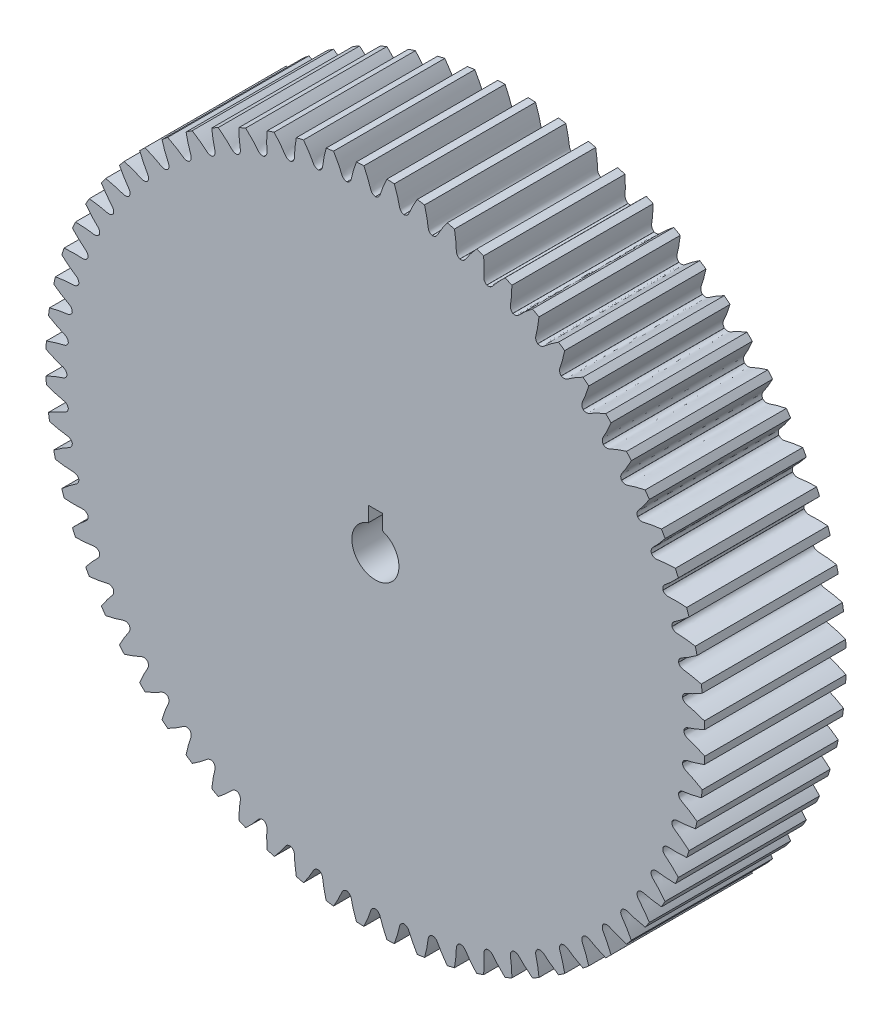
from build123d import *

# Parameters (mm, degrees)
SKETCH_1_R               = 70
EXTRUDE_1_DEPTH          = 30
CUT_EXTRUDE_1_DEPTH      = 104.440804328
PATTERN_CIRCULAR_1_COUNT = 68
CUT_EXTRUDE_2_DEPTH      = 104.383147826
SKETCH_5_R               = 27.463688529
EXTRUDE_2_DEPTH          = 30
CUT_EXTRUDE_3_DEPTH      = 104.383147826


with BuildPart() as part:
    # 草图1 → 凸台-拉伸1 (new body)
    with BuildSketch(Plane.XY):
        Circle(SKETCH_1_R)
    extrude(amount=EXTRUDE_1_DEPTH)

    # 草图2 → 切除-拉伸1 (cut, through all)
    with BuildSketch(Plane.XY):
        with BuildLine():
            ThreePointArc((0.01, 65.499649304), (0, 65.499650068), (-0.01, 65.499649304))
            add(Edge.make_bspline(
                [(-0.01, 65.499649304), (-0.857587595, 65.66462313), (-1.007289379, 66.405750738), (-1.29501968, 67.239333624), (-1.440868809, 67.645752042), (-1.604782578, 68.07254001), (-1.786581707, 68.519791422), (-1.987452059, 68.986758766), (-2.208162198, 69.472904865), (-2.449580979, 69.97759743), (-2.712526699, 70.50019807), (-2.997809722, 71.040037162), (-3.306219333, 71.596421649), (-3.63852663, 72.168633405), (-3.99548284, 72.755930322), (-4.377818951, 73.357546641), (-4.786244994, 73.972693516), (-5.221449429, 74.600559538), (-5.684098533, 75.240311292), (-6.174835778, 75.891093916), (-6.694281313, 76.552031686), (-7.243031118, 77.222228616), (-8.025589969, 78.139915494), (-8.64184767, 78.819589325), (-9.067170169, 79.270739462)],
                knots=[0, 0, 0, 0, 0.108777191, 0.133167644, 0.159093303, 0.18655417, 0.215550244, 0.246081525, 0.278148013, 0.311749708, 0.346886611, 0.383558721, 0.421766038, 0.461508562, 0.502786293, 0.545599231, 0.589947377, 0.63583073, 0.68324929, 0.732203057, 0.782692031, 0.834716213, 0.888275601, 1, 1, 1, 1], degree=3))
            ThreePointArc((-9.067170169, 79.270739462), (0, 79.787616268), (9.067170169, 79.270739462))
            add(Edge.make_bspline(
                [(0.01, 65.499649304), (0.857587595, 65.66462313), (1.007289379, 66.405750738), (1.29501968, 67.239333624), (1.440868809, 67.645752042), (1.604782578, 68.07254001), (1.786581707, 68.519791422), (1.987452059, 68.986758766), (2.208162198, 69.472904865), (2.449580979, 69.97759743), (2.712526699, 70.50019807), (2.997809722, 71.040037162), (3.306219333, 71.596421649), (3.63852663, 72.168633405), (3.99548284, 72.755930322), (4.377818951, 73.357546641), (4.786244994, 73.972693516), (5.221449429, 74.600559538), (5.684098533, 75.240311292), (6.174835778, 75.891093916), (6.694281313, 76.552031686), (7.243031118, 77.222228616), (8.025589969, 78.139915494), (8.64184767, 78.819589325), (9.067170169, 79.270739462)],
                knots=[0, 0, 0, 0, 0.108777191, 0.133167644, 0.159093303, 0.18655417, 0.215550244, 0.246081525, 0.278148013, 0.311749708, 0.346886611, 0.383558721, 0.421766038, 0.461508562, 0.502786293, 0.545599231, 0.589947377, 0.63583073, 0.68324929, 0.732203057, 0.782692031, 0.834716213, 0.888275601, 1, 1, 1, 1], degree=3))
        make_face()
    cut_extrude_1 = extrude(amount=CUT_EXTRUDE_1_DEPTH, mode=Mode.SUBTRACT)

    # 阵列(圆周)1: 切除-拉伸1 ×68 about axis
    pattern_circular_1_axis = Axis((0, 0, -1.5), (0, 0, 1))
    for i in range(1, PATTERN_CIRCULAR_1_COUNT):
        add(cut_extrude_1.rotate(pattern_circular_1_axis, i * 360 / PATTERN_CIRCULAR_1_COUNT), mode=Mode.SUBTRACT)

    # 草图4 → 切除-拉伸2 (cut, through all)
    with BuildSketch(Plane.XY.offset(30)):
        with BuildLine():
            Line((5, 0), (0, 0))
            Line((0, 0), (-5, 0))
            Line((-5, 0), (-5, 14.142135624))
            ThreePointArc((-5, 14.142135624), (-8.660254038, -12.247448714), (15, 0))
            ThreePointArc((15, 0), (12.247448714, 8.660254038), (5, 14.142135624))
            Line((5, 14.142135624), (5, 0))
        make_face()
        with BuildLine():
            Line((-5, 0), (0, 0))
            Line((0, 0), (5, 0))
            Line((5, 0), (5, 14.142135624))
            ThreePointArc((5, 14.142135624), (0, 15), (-5, 14.142135624))
            Line((-5, 14.142135624), (-5, 0))
        make_face()
        with BuildLine():
            Line((-5, 20), (-5, 14.142135624))
            ThreePointArc((-5, 14.142135624), (0, 15), (5, 14.142135624))
            Line((5, 14.142135624), (5, 20))
            Line((5, 20), (-5, 20))
        make_face()
    extrude(amount=-CUT_EXTRUDE_2_DEPTH, mode=Mode.SUBTRACT)

    # 草图5 → 凸台-拉伸2 (add, through all)
    with BuildSketch(Plane.XY.offset(30)):
        Circle(SKETCH_5_R)
    extrude(amount=-EXTRUDE_2_DEPTH)

    # 草图6 → 切除-拉伸3 (cut, through all)
    with BuildSketch(Plane.XY.offset(30)):
        with BuildLine():
            Line((1.5, 0), (0, 0))
            Line((0, 0), (-1.5, 0))
            Line((-1.5, 0), (-1.5, 4.769696007))
            ThreePointArc((-1.5, 4.769696007), (-2.958039892, -4.031128874), (5, 0))
            ThreePointArc((5, 0), (4.031128874, 2.958039892), (1.5, 4.769696007))
            Line((1.5, 4.769696007), (1.5, 0))
        make_face()
        with BuildLine():
            Line((-1.5, 0), (0, 0))
            Line((0, 0), (1.5, 0))
            Line((1.5, 0), (1.5, 4.769696007))
            ThreePointArc((1.5, 4.769696007), (0, 5), (-1.5, 4.769696007))
            Line((-1.5, 4.769696007), (-1.5, 0))
        make_face()
        with BuildLine():
            Line((-1.5, 8), (-1.5, 4.769696007))
            ThreePointArc((-1.5, 4.769696007), (0, 5), (1.5, 4.769696007))
            Line((1.5, 4.769696007), (1.5, 8))
            Line((1.5, 8), (-1.5, 8))
        make_face()
    extrude(amount=-CUT_EXTRUDE_3_DEPTH, mode=Mode.SUBTRACT)


solid = part.part
